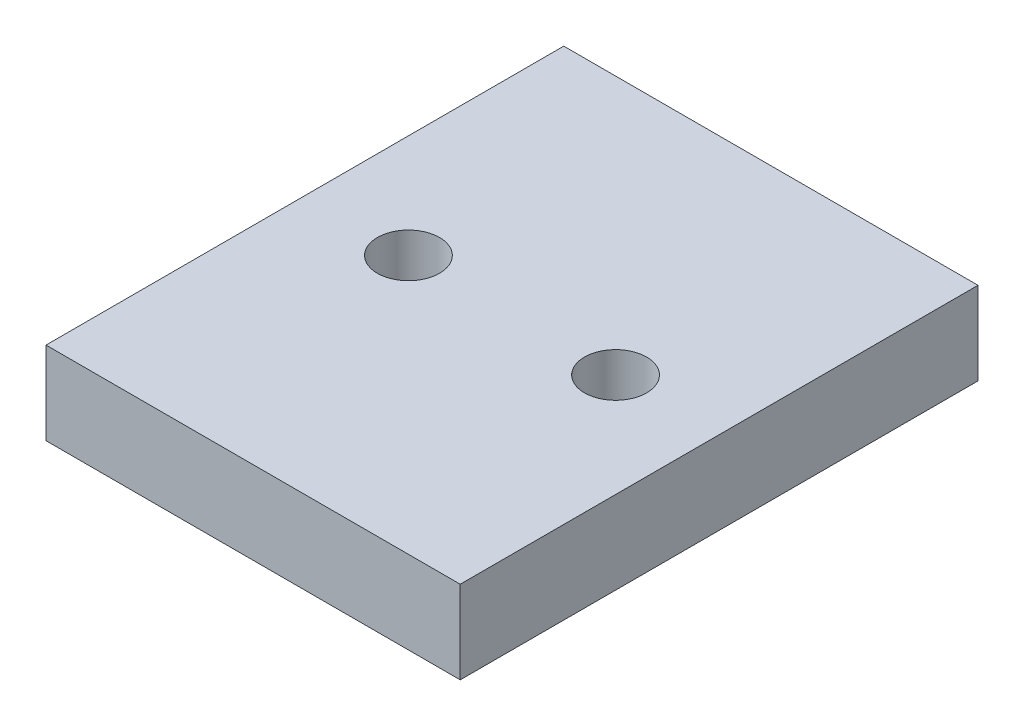
from build123d import *

# Parameters (mm, degrees)
SKETCH2_W                    = 25
SKETCH2_H                    = 4
PROFILEBOSS_EXTRUDE1_DEPTH   = 20
MOUNTHOLESSKETCH5_R          = 1.5
MOUNTHOLESCUT_EXTRUDE2_DEPTH = 33.26453161


with BuildPart() as part:
    # Sketch2 → ProfileBoss-Extrude1 (new body)
    with BuildSketch(Plane(origin=(0, 0, 0), x_dir=(0, 0, -1), z_dir=(1, 0, 0))):
        with Locations((12.5, 2)):
            Rectangle(SKETCH2_W, SKETCH2_H)
    extrude(amount=PROFILEBOSS_EXTRUDE1_DEPTH)

    # MountHolesSketch5 → MountHolesCut-Extrude2 (cut, through all)
    with BuildSketch(Plane(origin=(0, 4, 0), x_dir=(1, 0, 0), z_dir=(0, 1, 0))):
        with Locations((5, 12.5)):
            Circle(MOUNTHOLESSKETCH5_R)
        with Locations((15, 12.5)):
            Circle(MOUNTHOLESSKETCH5_R)
    extrude(amount=-MOUNTHOLESCUT_EXTRUDE2_DEPTH, mode=Mode.SUBTRACT)


solid = part.part
